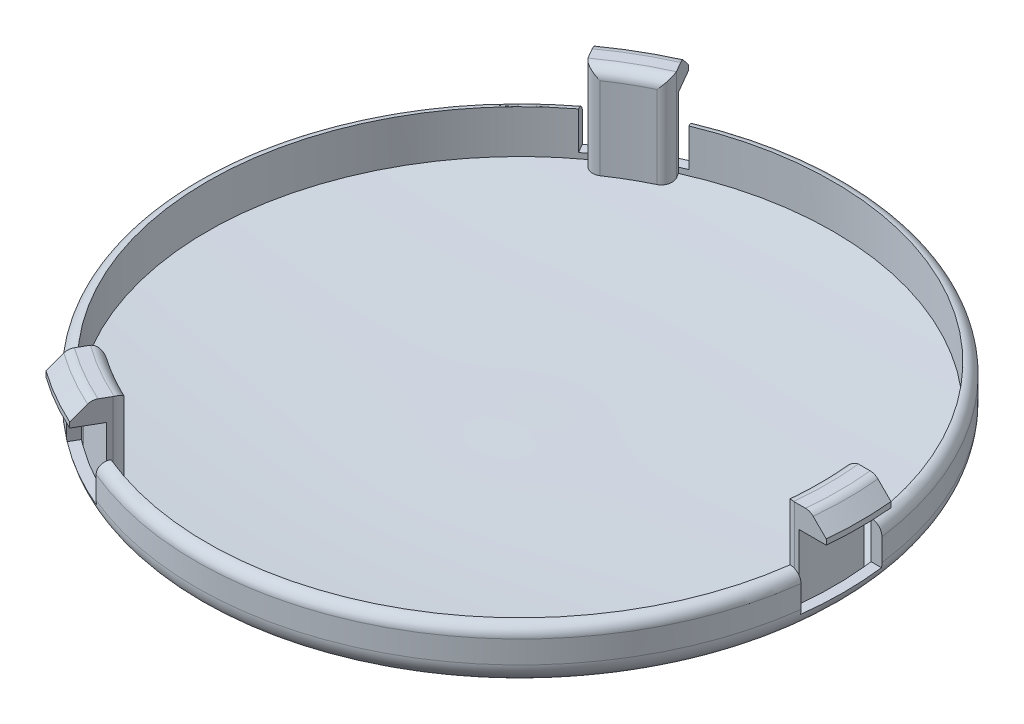
from build123d import *

# Parameters (mm, degrees)
CUT_EXTRUDE1_DEPTH  = 3.5
FILLET1_R           = 2
FILLET2_R           = 1
BOSS_EXTRUDE1_REACH = 45.718
BOSS_EXTRUDE2_DEPTH = 2
CHAMFER1_SIZE       = 1.5
FILLET3_R           = 1


# Some blends are built 0.0001 mm under size
with BuildPart() as part:
    # Sketch1 → Revolve1 (revolve)
    with BuildSketch(Plane.XY, mode=Mode.PRIVATE) as revolve1_sk:
        with BuildLine():
            Line((-30, 5.999999999999998), (-30, 1.0851831520279802))
            ThreePointArc((-30.000000000000004, 1.0851831520279802), (-15.014767181239076, 0.1343306301400844), (-2.66e-15, -0.00016711718706119))
            Line((-9.99999996e-09, -0.0001671173694977), (-9.99999996e-09, 0.9999999998168148))
            ThreePointArc((0, 0.9999999999999432), (-14.51319884389439, 1.1172335270625808), (-28.999999999999996, 2))
            Line((-28.999999999999996, 1.9999999999999982), (-28.999999999999996, 5.999999999999998))
            Line((-28.999999999999996, 5.999999999999998), (-30, 5.999999999999998))
        make_face()
    revolve(revolve1_sk.sketch.rotate(Axis((0, 2, 0), (0, 1, 0)), 270), axis=Axis((0, 2, 0), (0, 1, 0)))

    # Sketch2 → Cut-Extrude1 (cut)
    with BuildSketch(Plane(origin=(0, 5.999999999999998, 0), x_dir=(1, 0, 0), z_dir=(0, 1, 0))):
        with BuildLine():
            ThreePointArc((28.999999999999993, 0), (28.93906623396978, -1.8789479785001675), (28.756520999592418, -3.7499999999999996))
            Line((28.75652099959242, -3.75), (29.764702249476645, -3.75))
            ThreePointArc((29.76470224947665, -3.75), (29.9411177770996, -1.8786873762950393), (30, -6.7e-16))
            ThreePointArc((30, -6.7e-16), (29.9411177770996, 1.8786873762950391), (29.764702249476642, 3.7500000000000018))
            Line((29.764702249476645, 3.75), (28.75652099959242, 3.75))
            ThreePointArc((28.756520999592418, 3.750000000000001), (28.93906623396978, 1.8789479785001686), (28.999999999999993, 0))
        make_face()
        with BuildLine():
            Line((-11.634755860546809, -27.651988284126553), (-11.130665235604694, -26.77887771010767))
            ThreePointArc((-11.130665235604694, -26.77887771010767), (-12.842316439096853, -26.00144050775078), (-14.500000007500123, -25.114736705418526))
            ThreePointArc((-14.500000007500129, -25.114736705418533), (-16.096749802357415, -24.122492528764663), (-17.62585576398797, -23.02887771010764))
            Line((-17.625855763987968, -23.028877710107636), (-18.129946388930083, -23.90198828412652))
            ThreePointArc((-18.129946388930083, -23.901988284126517), (-16.597549885797623, -24.990424922126863), (-15.000000007500129, -25.980762109202963))
            ThreePointArc((-15.000000007500127, -25.98076210920297), (-13.343567898787512, -26.8691122988916), (-11.63475586054681, -27.651988284126553))
        make_face()
        with BuildLine():
            ThreePointArc((-14.500000007499764, 25.11473670541872), (-12.842316439096484, 26.00144050775095), (-11.130665235604317, 26.778877710107814))
            Line((-11.130665235604317, 26.77887771010782), (-11.63475586054642, 27.651988284126706))
            ThreePointArc((-11.634755860546422, 27.65198828412671), (-13.343567898787132, 26.86911229889178), (-15.000000007499755, 25.98076210920317))
            ThreePointArc((-15.000000007499754, 25.98076210920317), (-16.59754988579726, 24.990424922127097), (-18.129946388929742, 23.901988284126766))
            Line((-18.129946388929742, 23.901988284126766), (-17.62585576398764, 23.028877710107878))
            ThreePointArc((-17.625855763987644, 23.02887771010788), (-16.096749802357074, 24.12249252876488), (-14.50000000749977, 25.114736705418732))
        make_face()
    extrude(amount=-CUT_EXTRUDE1_DEPTH, mode=Mode.SUBTRACT)

    # Fillet1
    # the kernel refuses this fillet: 2 mm, written as the material it takes off along each edge
    with BuildSketch(Plane(origin=(0, 1.0851831520279802, 0), x_dir=(2.2e-16, 0, -1), z_dir=(1, 0, 2.2e-16))) as fillet1_piece_1:
        with BuildLine():
            CenterArc((28, 1.8326988051735489), FILLET1_R, 274.80759598574514, 85.19240401425486)
            ThreePointArc((28.1676199051974, -0.1602647086373823), (29.083943461552035, -0.0816588235622362), (30.000000000000004, 0))
            Line((30.000000000000004, 0), (30, 1.8326988051735489))
        make_face()
    revolve(axis=Axis((0, 1.0851831520279802, 0), (0, 1, 0)), mode=Mode.SUBTRACT)

    # Fillet2
    fillet2_edges = [part.edges().sort_by_distance(p)[0] for p in [
        (14.999999999999929, 5.999999999999998, 25.980762113533203),
        (-30, 5.999999999999998, -2.2166e-13),
        (15.000000000000123, 5.999999999999998, -25.980762113533093),
    ]]
    fillet(fillet2_edges, radius=FILLET2_R - 0.0001)  # a hair under: the kernel refuses the full size

    # Sketch3 → Boss-Extrude1 (add, up to next)
    with BuildSketch(Plane(origin=(0, 10.499999999999998, 0), x_dir=(1, 0, 0), z_dir=(0, 1, 0)), mode=Mode.PRIVATE) as boss_extrude1_sk1:
        with BuildLine():
            Line((-11.069860721483089, 25.173561202320297), (-11.82412889050239, 26.479991993593703))
            ThreePointArc((-11.82412889050239, 26.479991993593703), (-14.49999999999976, 25.114736709748858), (-17.020281313209054, 23.479991993593746))
            Line((-17.020281313209054, 23.479991993593746), (-16.266013144189753, 22.173561202320343))
            ThreePointArc((-16.266013144189753, 22.173561202320343), (-13.74999999999977, 23.81569860407219), (-11.069860721483089, 25.173561202320297))
        make_face()
    boss_extrude1_tool1 = extrude(boss_extrude1_sk1.sketch, amount=-BOSS_EXTRUDE1_REACH, mode=Mode.PRIVATE) - part.part
    # Sketch3 → Boss-Extrude1 (add, up to next)
    with BuildSketch(Plane(origin=(0, 10.499999999999998, 0), x_dir=(1, 0, 0), z_dir=(0, 1, 0)), mode=Mode.PRIVATE) as boss_extrude1_sk2:
        with BuildLine():
            Line((28.844410203711966, 2.9999999999995914), (27.335873865673342, 2.9999999999996123))
            ThreePointArc((27.33587386567335, 2.9999999999996136), (27.458937809992022, 1.5022431051569778), (27.50000000000002, 4.88e-15))
            ThreePointArc((27.499999999999996, 4.44e-15), (27.458937809991976, -1.502243105157361), (27.335873865673246, -3.00000000000039))
            Line((27.335873865673257, -3.000000000000393), (28.84441020371188, -3.000000000000414))
            ThreePointArc((28.844410203711867, -3.0000000000004103), (28.96107642947378, -1.5020159939820452), (28.999999999999993, 5.33e-15))
            ThreePointArc((29.000000000000007, 4.88e-15), (28.961076429473817, 1.5020159939816335), (28.844410203711963, 2.9999999999995914))
        make_face()
    boss_extrude1_tool2 = extrude(boss_extrude1_sk2.sketch, amount=-BOSS_EXTRUDE1_REACH, mode=Mode.PRIVATE) - part.part
    # Sketch3 → Boss-Extrude1 (add, up to next)
    with BuildSketch(Plane(origin=(0, 10.499999999999998, 0), x_dir=(1, 0, 0), z_dir=(0, 1, 0)), mode=Mode.PRIVATE) as boss_extrude1_sk3:
        with BuildLine():
            Line((-11.824128890503124, -26.47999199359337), (-11.069860721483785, -25.173561202319984))
            ThreePointArc((-11.069860721483785, -25.173561202319988), (-12.428488213270146, -24.531259256968543), (-13.75000000000011, -23.815698604071994))
            ThreePointArc((-13.750000000000107, -23.815698604071986), (-15.030449596722384, -23.029016151811334), (-16.266013144190367, -22.173561202319885))
            Line((-16.266013144190367, -22.173561202319885), (-17.020281313209708, -23.47999199359327))
            ThreePointArc((-17.020281313209708, -23.47999199359327), (-15.781322222415982, -24.330019911875922), (-14.500000000000108, -25.114736709748644))
            ThreePointArc((-14.500000000000115, -25.114736709748655), (-13.17975420705839, -25.832035905857804), (-11.824128890503127, -26.47999199359338))
        make_face()
    boss_extrude1_tool3 = extrude(boss_extrude1_sk3.sketch, amount=-BOSS_EXTRUDE1_REACH, mode=Mode.PRIVATE) - part.part
    add(boss_extrude1_tool1.solids().sort_by_distance((-14.098347, 10.5, -24.419053))[0])
    add(boss_extrude1_tool2.solids().sort_by_distance((28.196694, 10.5, 0))[0])
    add(boss_extrude1_tool3.solids().sort_by_distance((-14.098347, 10.5, 24.419053))[0])

    # Sketch4 → Boss-Extrude2 (add)
    with BuildSketch(Plane(origin=(0, 10.499999999999998, 0), x_dir=(1, 0, 0), z_dir=(0, 1, 0))):
        with BuildLine():
            Line((-18.276484931628595, 25.655800485347424), (-17.020281313209054, 23.479991993593746))
            ThreePointArc((-17.020281313209054, 23.479991993593746), (-14.49999999999976, 25.114736709748858), (-11.82412889050239, 26.479991993593703))
            Line((-11.82412889050239, 26.479991993593703), (-13.080332508921968, 28.655800485347445))
            ThreePointArc((-13.080332508921968, 28.655800485347445), (-15.750000000000124, 27.27980021920974), (-18.276484931628595, 25.655800485347424))
        make_face()
        with BuildLine():
            Line((31.356817440550305, -3.000000000000006), (28.844410203711874, -3.0000000000004103))
            ThreePointArc((28.844410203711874, -3.0000000000004103), (29.000000000000004, -4.097e-13), (28.84441020371196, 2.999999999999595))
            Line((28.84441020371196, 2.999999999999595), (31.35681744055032, 3.0000000000000027))
            ThreePointArc((31.35681744055032, 3.0000000000000027), (31.499999999999996, -2.19e-15), (31.356817440550305, -3.000000000000006))
        make_face()
        with BuildLine():
            Line((-18.27648493162859, -25.655800485347413), (-17.020281313209722, -23.479991993593266))
            ThreePointArc((-17.020281313209722, -23.479991993593266), (-14.500000000000473, -25.114736709748446), (-11.824128890503138, -26.479991993593366))
            Line((-11.824128890503138, -26.479991993593366), (-13.080332508921975, -28.655800485347452))
            ThreePointArc((-13.080332508921975, -28.655800485347452), (-15.750000000000123, -27.279800219209736), (-18.27648493162859, -25.655800485347413))
        make_face()
    extrude(amount=-BOSS_EXTRUDE2_DEPTH)

    # Chamfer1
    chamfer1_edges = [part.edges().sort_by_distance(p)[0] for p in [
        (-15.750000000000126, 10.499999999999998, -27.279800219209733),
        (31.499999999999996, 10.499999999999998, 2.11e-15),
        (-15.750000000000123, 10.499999999999998, 27.27980021920973),
    ]]
    chamfer(chamfer1_edges, length=CHAMFER1_SIZE)

    # Fillet3
    fillet3_edges = [part.edges().sort_by_distance(p)[0] for p in [
        (-11.069860721483787, 6.186462268747807, 25.173561202319988),
        (-16.266013144190367, 6.186462268747845, 22.173561202319885),
        (-11.06986072148309, 6.186462268747845, -25.1735612023203),
        (-16.266013144189753, 6.186462268747845, -22.173561202320343),
        (27.335873865673346, 6.186462268747827, -2.9999999999996128),
        (27.33587386567325, 6.186462268747845, 3.0000000000003917),
        (29.999999999999993, 10.499999999999998, 4.2755e-13),
        (-15.000000000000474, 10.499999999999998, 25.98076211353287),
        (-14.999999999999757, 10.499999999999998, -25.98076211353329),
        (-13.74999999999978, 10.499999999999998, -23.815698604072196),
        (-13.75000000000043, 10.499999999999998, 23.815698604071798),
        (27.499999999999993, 10.499999999999998, 3.9269e-13),
    ]]
    fillet(fillet3_edges, radius=FILLET3_R)


solid = part.part
